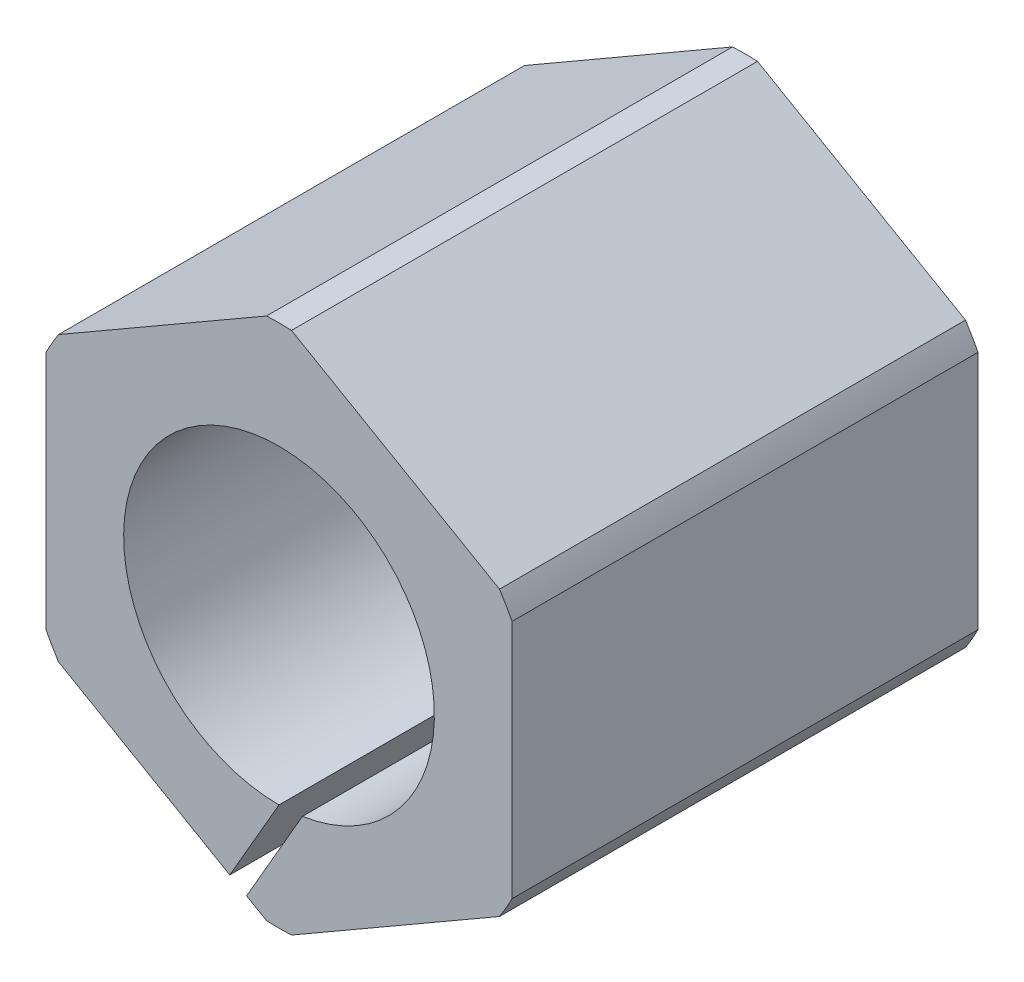
from build123d import *

# Parameters (mm, degrees)
SKETCH1_R         = 6.35
EXTRUDE1_DEPTH    = 9.525
SKETCH2_OUTSIDE_W = 28.006
SKETCH2_OUTSIDE_H = 30.954
SKETCH2_OUTSIDE_R = 10.715625
EXTRUDE2_DEPTH    = 24.970724332
EXTRUDE3_DEPTH    = 24.842247045


with BuildPart() as part:
    # Sketch1 → Extrude1 (new, symmetric)
    with BuildSketch(Plane.XY):
        Polygon((0, 10.998522628), (-9.525, 5.499261314), (-9.525, -5.499261314), (0, -10.998522628), (9.525, -5.499261314), (9.525, 5.499261314), align=None)
        Circle(SKETCH1_R, mode=Mode.SUBTRACT)
    extrude(amount=EXTRUDE1_DEPTH, both=True)

    # Sketch2 outside → Extrude2 (cut, through all)
    with BuildSketch(Plane.XY.offset(9.525)):
        Rectangle(SKETCH2_OUTSIDE_W, SKETCH2_OUTSIDE_H)
        Circle(SKETCH2_OUTSIDE_R, mode=Mode.SUBTRACT)
    extrude(amount=-EXTRUDE2_DEPTH, mode=Mode.SUBTRACT)

    # Sketch3 → Extrude3 (cut, through all)
    with BuildSketch(Plane.XY.offset(9.525)):
        Polygon((3.437038321, -1.984375), (-1.325461679, -10.233266971), (-2.012869343, -9.836391971), (2.749630657, -1.5875), align=None)
    extrude(amount=-EXTRUDE3_DEPTH, mode=Mode.SUBTRACT)


solid = part.part
